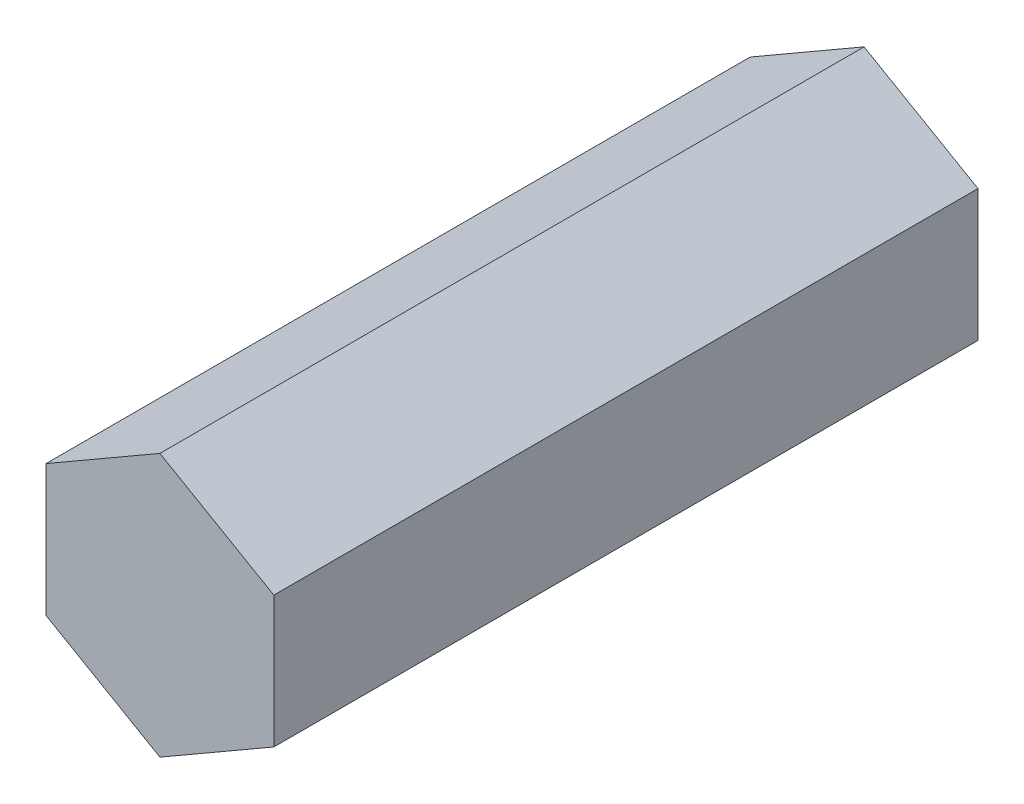
from build123d import *

# Parameters (mm, degrees)
BOSS_EXTRUDE1_DEPTH = 19.62785


with BuildPart() as part:
    # Sketch1 → Boss-Extrude1 (new, symmetric)
    with BuildSketch(Plane.XY):
        Polygon((0, 7.332348419), (-6.35, 3.666174209), (-6.35, -3.666174209), (0, -7.332348419), (6.35, -3.666174209), (6.35, 3.666174209), align=None)
    extrude(amount=BOSS_EXTRUDE1_DEPTH, both=True)


solid = part.part
